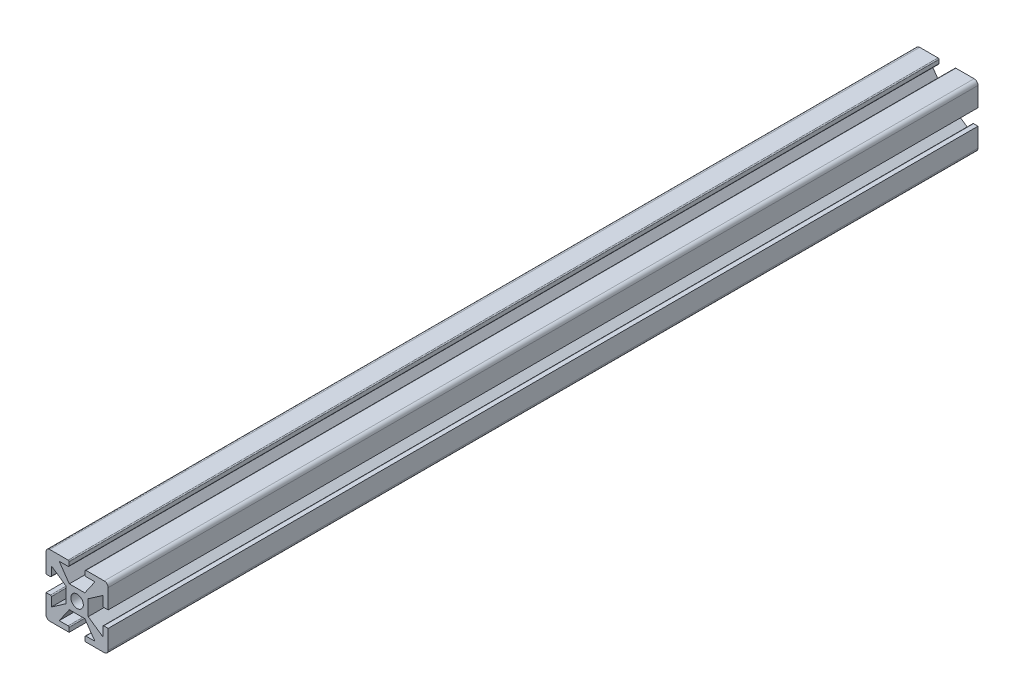
from build123d import *

# Parameters (mm, degrees)
SKETCH1_W           = 25.4
SKETCH1_H           = 25.4
BOSS_EXTRUDE1_DEPTH = 355.6
FILLET1_R           = 1.5875
HOLE1_OUTLINE_R     = 2.5527
HOLE1_DEPTH         = 355.6
SKETCH7_W           = 6.5278
SKETCH7_H           = 2.2352
CUT_EXTRUDE2_DEPTH  = 355.6
FILLET4_R           = 0.396875
CIRPATTERN2_DEPTH   = 355.6


# Read off the part's stored shape, not the designer's step: Hole1, CirPattern2
with BuildPart() as part:
    # Sketch1 → Boss-Extrude1 (new body)
    with BuildSketch(Plane.XY):
        Rectangle(SKETCH1_W, SKETCH1_H)
    extrude(amount=BOSS_EXTRUDE1_DEPTH)

    # Fillet1
    fillet1_edges = [part.edges().sort_by_distance(p)[0] for p in [
        (12.7, -12.7, 177.8),
        (-12.7, -12.7, 177.8),
        (-12.7, 12.7, 177.8),
        (12.7, 12.7, 177.8),
    ]]
    fillet(fillet1_edges, radius=FILLET1_R)

    # Hole1 outline → Hole1 (cut)
    with BuildSketch(Plane.XY):
        with Locations((0, -0.048792482)):
            Circle(HOLE1_OUTLINE_R)
    extrude(amount=HOLE1_DEPTH, mode=Mode.SUBTRACT)

    # Sketch7 → Cut-Extrude2 (cut)
    with BuildSketch(Plane.XY.offset(355.6)):
        with Locations((0, 11.5824)):
            Rectangle(SKETCH7_W, SKETCH7_H)
        Polygon((-3.175, 4.5212), (-7.3025, 10.4648), (7.3025, 10.4648), (3.175, 4.5212), align=None)
    extrude(amount=-CUT_EXTRUDE2_DEPTH, mode=Mode.SUBTRACT)

    # Fillet4
    fillet4_edges = [part.edges().sort_by_distance(p)[0] for p in [
        (-3.2639, 10.4648, 177.8),
        (-3.2639, 12.7, 177.8),
        (3.2639, 12.7, 177.8),
        (3.2639, 10.4648, 177.8),
    ]]
    fillet(fillet4_edges, radius=FILLET4_R)

    # CirPattern2 outline → CirPattern2 (cut)
    with BuildSketch(Plane.XY):
        with BuildLine():
            ThreePointArc((-3.660775, -10.562384964), (-3.380141996, -10.67862696), (-3.2639, -10.959259964))
            Line((-3.2639, -10.959259964), (-3.2639, -12.7))
            Line((-3.2639, -12.7), (3.2639, -12.7))
            Line((3.2639, -12.7), (3.2639, -10.959259964))
            ThreePointArc((3.2639, -10.959259964), (3.380141996, -10.67862696), (3.660775, -10.562384964))
            Line((3.660775, -10.562384964), (7.3025, -10.562384964))
            Line((7.3025, -10.562384964), (3.175, -4.618784964))
            Line((3.175, -4.618784964), (-3.175, -4.618784964))
            Line((-3.175, -4.618784964), (-7.3025, -10.562384964))
            Line((-7.3025, -10.562384964), (-3.660775, -10.562384964))
        make_face()
        with BuildLine():
            Line((-12.7, -3.312692482), (-10.910467482, -3.312692482))
            ThreePointArc((-10.910467482, -3.312692482), (-10.629834478, -3.428934478), (-10.513592482, -3.709567482))
            Line((-10.513592482, -3.709567482), (-10.513592482, -7.351292482))
            Line((-10.513592482, -7.351292482), (-4.569992482, -3.223792482))
            Line((-4.569992482, -3.223792482), (-4.569992482, 3.126207518))
            Line((-4.569992482, 3.126207518), (-10.513592482, 7.253707518))
            Line((-10.513592482, 7.253707518), (-10.513592482, 3.611982518))
            ThreePointArc((-10.513592482, 3.611982518), (-10.629834478, 3.331349514), (-10.910467482, 3.215107518))
            Line((-10.910467482, 3.215107518), (-12.7, 3.215107518))
            Line((-12.7, 3.215107518), (-12.7, -3.312692482))
        make_face()
        with BuildLine():
            ThreePointArc((10.513592482, -3.709567482), (10.629834478, -3.428934478), (10.910467482, -3.312692482))
            Line((10.910467482, -3.312692482), (12.7, -3.312692482))
            Line((12.7, -3.312692482), (12.7, 3.215107518))
            Line((12.7, 3.215107518), (10.910467482, 3.215107518))
            ThreePointArc((10.910467482, 3.215107518), (10.629834478, 3.331349514), (10.513592482, 3.611982518))
            Line((10.513592482, 3.611982518), (10.513592482, 7.253707518))
            Line((10.513592482, 7.253707518), (4.569992482, 3.126207518))
            Line((4.569992482, 3.126207518), (4.569992482, -3.223792482))
            Line((4.569992482, -3.223792482), (10.513592482, -7.351292482))
            Line((10.513592482, -7.351292482), (10.513592482, -3.709567482))
        make_face()
    extrude(amount=CIRPATTERN2_DEPTH, mode=Mode.SUBTRACT)


solid = part.part
